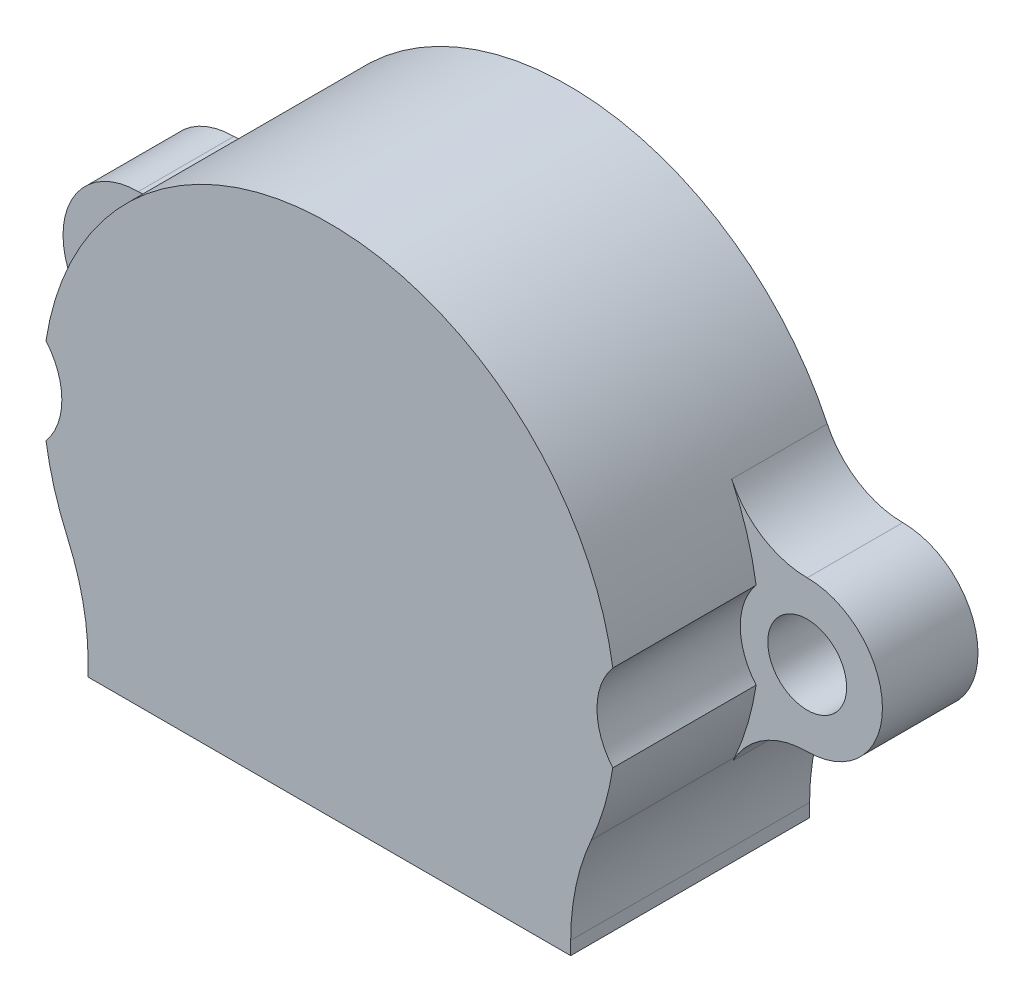
from build123d import *

# Parameters (mm, degrees)
BOSS_EXTRUDE1_DEPTH = 10
BOSS_EXTRUDE2_START = -0.8
BOSS_EXTRUDE2_DEPTH = 0.8
FILLET1_R           = 10
SKETCH3_R           = 1.65
BOSS_EXTRUDE4_DEPTH = 4
SKETCH4_R           = 2.8
CUT_EXTRUDE1_DEPTH  = 22.774354181


with BuildPart() as part:
    # Sketch1 → Boss-Extrude1 (new body)
    with BuildSketch(Plane.XY):
        with BuildLine():
            Line((-7.6, -4.13067791), (-7.6, -9.5))
            Line((-7.6, -9.5), (-10.1, -9.5))
            Line((-10.1, -9.5), (-10.1, -6.479969136))
            ThreePointArc((-10.1, -6.479969136), (0, 12), (10.1, -6.479969136))
            Line((10.1, -6.479969136), (10.1, -9.5))
            Line((10.1, -9.5), (7.6, -9.5))
            Line((7.6, -9.5), (7.6, -4.13067791))
            ThreePointArc((7.6, -4.13067791), (0, 8.65), (-7.6, -4.13067791))
        make_face()
    extrude(amount=BOSS_EXTRUDE1_DEPTH)

    # Sketch2 → Boss-Extrude2 (add)
    with BuildSketch(Plane.XY.offset(10).offset(BOSS_EXTRUDE2_START)):
        with BuildLine():
            Line((7.6, -4.13067791), (7.6, -9.5))
            Line((7.6, -9.5), (-7.6, -9.5))
            Line((-7.6, -9.5), (-7.6, -4.13067791))
            ThreePointArc((-7.6, -4.13067791), (0, 8.65), (7.6, -4.13067791))
        make_face()
    extrude(amount=BOSS_EXTRUDE2_DEPTH)

    # Fillet1
    fillet1_edges = [part.edges().sort_by_distance(p)[0] for p in [
        (-10.1, -6.479969136, 5),
        (10.1, -6.479969136, 5),
    ]]
    fillet(fillet1_edges, radius=FILLET1_R)

    # Sketch3 → Boss-Extrude4 (add)
    # profile 1 of 2: a face of its own
    with BuildSketch(Plane(origin=(0, 0, 0), x_dir=(-1, 0, 0), z_dir=(0, 0, -1))):
        with BuildLine():
            ThreePointArc((14, 3.15), (17.15, 0), (14, -3.15))
            ThreePointArc((14, -3.15), (12.130662272, -3.6913019), (10.839796225, -5.147700243))
            ThreePointArc((10.839796225, -5.147700243), (12, 0), (10.839796225, 5.147700243))
            ThreePointArc((10.839796225, 5.147700243), (12.130662272, 3.6913019), (14, 3.15))
        make_face()
        with Locations((14, 0)):
            Circle(SKETCH3_R, mode=Mode.SUBTRACT)
    # profile 2 of 2: a face of its own
    with BuildSketch(Plane(origin=(0, 0, 0), x_dir=(-1, 0, 0), z_dir=(0, 0, -1))):
        with BuildLine():
            ThreePointArc((-10.839796225, 5.147700243), (-12, 0), (-10.839796225, -5.147700243))
            ThreePointArc((-10.839796225, -5.147700243), (-12.130662272, -3.6913019), (-14, -3.15))
            ThreePointArc((-14, -3.15), (-17.15, 0), (-14, 3.15))
            ThreePointArc((-14, 3.15), (-12.130662272, 3.6913019), (-10.839796225, 5.147700243))
        make_face()
        with Locations((-14, 0)):
            Circle(SKETCH3_R, mode=Mode.SUBTRACT)
    extrude(amount=-BOSS_EXTRUDE4_DEPTH)

    # Sketch4 → Cut-Extrude1 (cut, through all)
    with BuildSketch(Plane.XY.offset(4)):
        with Locations((-14, 0)):
            Circle(SKETCH4_R)
        with Locations((14, 0)):
            Circle(SKETCH4_R)
    extrude(amount=CUT_EXTRUDE1_DEPTH, mode=Mode.SUBTRACT)


solid = part.part
